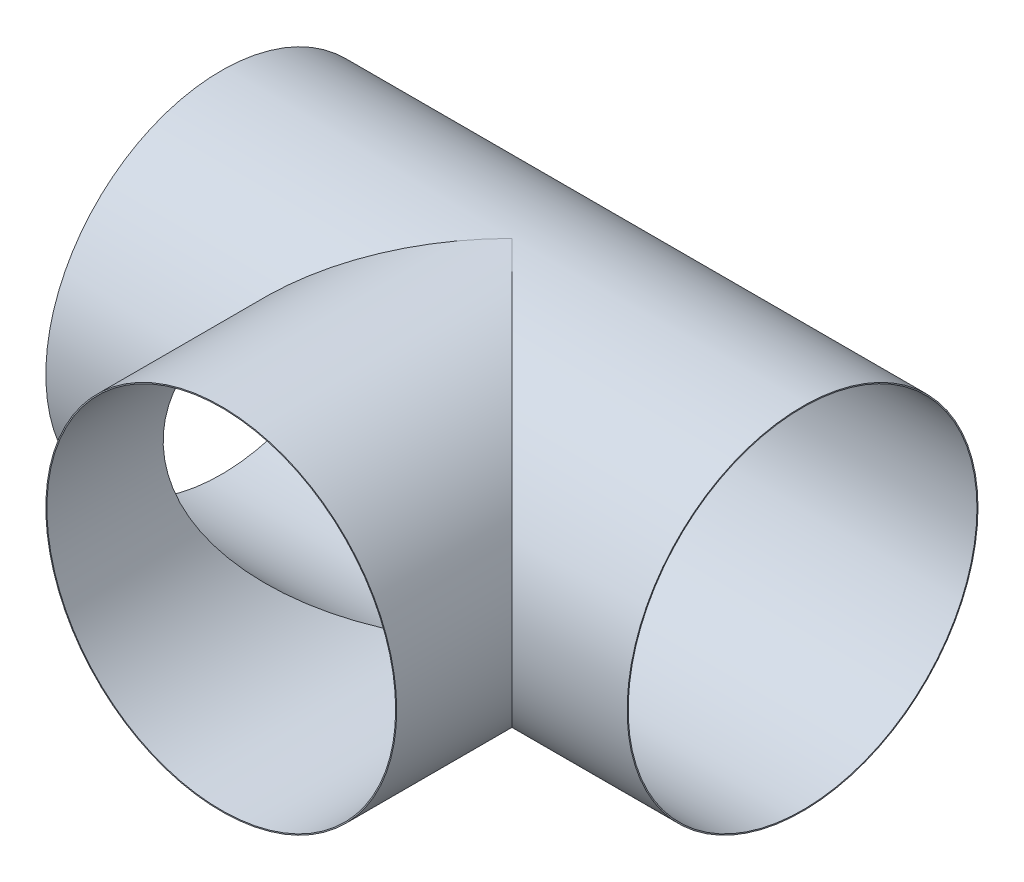
from build123d import *

# Parameters (mm, degrees)
SKETCH1_R           = 38.32733
BOSS_EXTRUDE2_DEPTH = 63.5
SKETCH2_R           = 38.32733
BOSS_EXTRUDE3_DEPTH = 127
SKETCH3_R           = 38.1
CUT_EXTRUDE1_DEPTH  = 168.232740096
SKETCH4_R           = 38.1
CUT_EXTRUDE2_DEPTH  = 63.5


with BuildPart() as part:
    # Sketch1 → Boss-Extrude2 (new body)
    with BuildSketch(Plane.XY):
        Circle(SKETCH1_R)
    extrude(amount=-BOSS_EXTRUDE2_DEPTH)

    # Sketch2 → Boss-Extrude3 (add)
    with BuildSketch(Plane(origin=(63.5, 0, 0), x_dir=(0, 0, -1), z_dir=(1, 0, 0))):
        with Locations((63.5, 0)):
            Circle(SKETCH2_R)
    extrude(amount=-BOSS_EXTRUDE3_DEPTH)

    # Sketch3 → Cut-Extrude1 (cut, through all)
    with BuildSketch(Plane(origin=(63.5, 0, 0), x_dir=(0, 0, -1), z_dir=(1, 0, 0))):
        with Locations((63.5, 0)):
            Circle(SKETCH3_R)
    extrude(amount=-CUT_EXTRUDE1_DEPTH, mode=Mode.SUBTRACT)

    # Sketch4 → Cut-Extrude2 (cut)
    with BuildSketch(Plane.XY):
        Circle(SKETCH4_R)
    extrude(amount=-CUT_EXTRUDE2_DEPTH, mode=Mode.SUBTRACT)


solid = part.part
